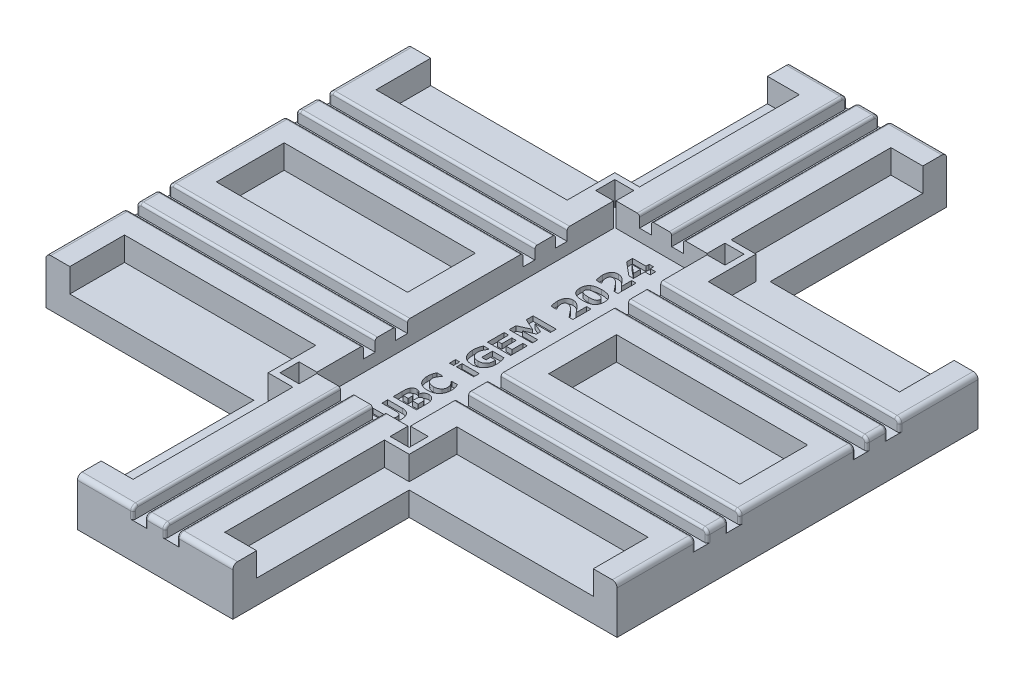
from build123d import *

# Parameters (mm, degrees)
SKETCH1_W                                  = 240
SKETCH1_H                                  = 200
BOSS_EXTRUDE1_DEPTH                        = 20
SKETCH7_W                                  = 120
SKETCH7_H                                  = 50
BOSS_EXTRUDE6_DEPTH                        = 20
FILLET1_R                                  = 2
SKETCH2_W                                  = 39.3
SKETCH2_H                                  = 125.7
CUT_EXTRUDE1_DEPTH                         = 10
CUT_EXTRUDE3_DEPTH                         = 5
MIRROR4_AT_THE_SECOND_PLANE_COPY_1_DEPTH   = 5
SKETCH11_W                                 = 104.748042719
SKETCH11_H                                 = 5
CUT_EXTRUDE4_DEPTH                         = 5
MIRROR6_AT_THE_SECOND_PLANE_COPY_1_SKETC_W = 104.748042719
MIRROR6_AT_THE_SECOND_PLANE_COPY_1_SKETC_H = 5
MIRROR6_AT_THE_SECOND_PLANE_COPY_1_DEPTH   = 5
SHELL1_START                               = 10
SHELL1_OUTLINE_W                           = 80.35
SHELL1_OUTLINE_H                           = 28.5
SHELL1_DEPTH                               = 10
FILLET3_R                                  = 1
SKETCH13_W                                 = 7.252545243
SKETCH13_H                                 = 2.335565418
SKETCH13_W_2                               = 1.720942939
SKETCH13_H_2                               = 2.581414408
CUT_EXTRUDE5_DEPTH                         = 2
CUT_EXTRUDE6_DEPTH                         = 10
MIRROR7_AT_THE_SECOND_PLANE_COPY_1_DEPTH   = 10
SKETCH15_W                                 = 101.789001661
SKETCH15_H                                 = 87.14110882
CUT_EXTRUDE7_DEPTH                         = 194.132079158


# Read off the part's stored shape, not the designer's step: Shell1
with BuildPart() as part:
    # Sketch1 → Boss-Extrude1 (new body)
    with BuildSketch(Plane(origin=(0, 0, 0), x_dir=(1, 0, 0), z_dir=(0, 1, 0))):
        Rectangle(SKETCH1_W, SKETCH1_H)
    extrude(amount=BOSS_EXTRUDE1_DEPTH)

    # Sketch7 → Boss-Extrude6 (add)
    with BuildSketch(Plane(origin=(0, 0, 0), x_dir=(1, 0, 0), z_dir=(0, 1, 0))):
        with Locations((0, 125)):
            Rectangle(SKETCH7_W, SKETCH7_H)
        with Locations((0, -125)):
            Rectangle(SKETCH7_W, SKETCH7_H)
    extrude(amount=BOSS_EXTRUDE6_DEPTH)

    # Fillet1
    fillet1_edges = [part.edges().sort_by_distance(p)[0] for p in [
        (-120, 20, 0),
        (90, 20, 100),
        (-90, 20, 100),
        (-60, 10, 150),
        (60, 10, 150),
        (-60, 20, 125),
        (0, 20, 150),
        (60, 20, 125),
        (-90, 20, -100),
        (60, 20, -125),
        (0, 20, -150),
        (60, 10, -150),
        (-60, 10, -150),
        (-60, 20, -125),
        (120, 20, 0),
        (120, 10, 100),
        (-120, 10, 100),
        (-120, 10, -100),
        (120, 10, -100),
        (90, 20, -100),
    ]]
    fillet(fillet1_edges, radius=FILLET1_R)

    # Sketch2 → Cut-Extrude1 (cut)
    with BuildSketch(Plane(origin=(0, 20, 0), x_dir=(1, 0, 0), z_dir=(0, 1, 0))):
        Rectangle(SKETCH2_W, SKETCH2_H)
    extrude(amount=-CUT_EXTRUDE1_DEPTH, mode=Mode.SUBTRACT)

    # Sketch10 → Cut-Extrude3 (cut)
    with BuildSketch(Plane(origin=(0, 20, 0), x_dir=(1, 0, 0), z_dir=(0, 1, 0))):
        Polygon((-9.25, -40.5), (-9.25, -33.162899401), (-4.25, -33.162899401), (-4.25, -40.5), (-4.25, -156.832928994), (-9.25, -156.832928994), align=None)
    cut_extrude3 = extrude(amount=-CUT_EXTRUDE3_DEPTH, mode=Mode.SUBTRACT)

    # Mirror4: Cut-Extrude3 across plane
    add(cut_extrude3.mirror(Plane(origin=(0, 0, 0), x_dir=(0, 0, 1), z_dir=(1, 0, 0))), mode=Mode.SUBTRACT)

    # Mirror4 at the second plane: Cut-Extrude3 across plane
    add(cut_extrude3.mirror(Plane.XY), mode=Mode.SUBTRACT)

    # Mirror4 at the second plane copy 1 sketc → Mirror4 at the second plane copy 1 (cut)
    with BuildSketch(Plane(origin=(0, 20, 0), x_dir=(-1, 0, 0), z_dir=(0, 1, 0))):
        Polygon((-9.25, -40.5), (-9.25, -33.162899401), (-4.25, -33.162899401), (-4.25, -40.5), (-4.25, -156.832928994), (-9.25, -156.832928994), align=None)
    extrude(amount=-MIRROR4_AT_THE_SECOND_PLANE_COPY_1_DEPTH, mode=Mode.SUBTRACT)

    # Sketch11 → Cut-Extrude4 (cut)
    with BuildSketch(Plane(origin=(0, 20, 0), x_dir=(1, 0, 0), z_dir=(0, 1, 0))):
        with Locations((-72.024021359, 26.75)):
            Rectangle(SKETCH11_W, SKETCH11_H)
        with Locations((-72.024021359, 40.35)):
            Rectangle(SKETCH11_W, SKETCH11_H)
    cut_extrude4 = extrude(amount=-CUT_EXTRUDE4_DEPTH, mode=Mode.SUBTRACT)

    # Mirror6: Cut-Extrude4 across plane
    add(cut_extrude4.mirror(Plane.XY), mode=Mode.SUBTRACT)

    # Mirror6 at the second plane: Cut-Extrude4 across plane
    add(cut_extrude4.mirror(Plane(origin=(0, 0, 0), x_dir=(0, 0, 1), z_dir=(1, 0, 0))), mode=Mode.SUBTRACT)

    # Mirror6 at the second plane copy 1 sketc → Mirror6 at the second plane copy 1 (cut)
    with BuildSketch(Plane(origin=(0, 20, 0), x_dir=(-1, 0, 0), z_dir=(0, 1, 0))):
        with Locations((-72.024021359, 26.75)):
            Rectangle(MIRROR6_AT_THE_SECOND_PLANE_COPY_1_SKETC_W, MIRROR6_AT_THE_SECOND_PLANE_COPY_1_SKETC_H)
        with Locations((-72.024021359, 40.35)):
            Rectangle(MIRROR6_AT_THE_SECOND_PLANE_COPY_1_SKETC_W, MIRROR6_AT_THE_SECOND_PLANE_COPY_1_SKETC_H)
    extrude(amount=-MIRROR6_AT_THE_SECOND_PLANE_COPY_1_DEPTH, mode=Mode.SUBTRACT)

    # Shell1 outline → Shell1 (cut)
    with BuildSketch(Plane(origin=(0, 0, 0), x_dir=(1, 0, 0), z_dir=(0, 1, 0)).offset(SHELL1_START)):
        Polygon((-29.65, 72.85), (-19.25, 72.85), (-19.25, 140), (-50, 140), (-50, 90), (-110, 90), (-110, 52.85), (-29.65, 52.85), align=None)
        Polygon((19.25, 72.85), (29.65, 72.85), (29.65, 52.85), (110, 52.85), (110, 90), (50, 90), (50, 140), (19.25, 140), align=None)
        Polygon((-110, -52.85), (-110, -90), (-50, -90), (-50, -140), (-19.25, -140), (-19.25, -72.85), (-29.65, -72.85), (-29.65, -52.85), align=None)
        with Locations((-69.825, 0)):
            Rectangle(SHELL1_OUTLINE_W, SHELL1_OUTLINE_H)
        Polygon((29.65, -72.85), (19.25, -72.85), (19.25, -140), (50, -140), (50, -90), (110, -90), (110, -52.85), (29.65, -52.85), align=None)
        with Locations((69.825, 0)):
            Rectangle(SHELL1_OUTLINE_W, SHELL1_OUTLINE_H)
    extrude(amount=SHELL1_DEPTH, mode=Mode.SUBTRACT)

    # Fillet3
    fillet3_edges = [part.edges().sort_by_distance(p)[0] for p in [
        (-4.25, 16.5, 150),
        (-4.25, 19.414213562, 149.414213562),
        (-9.25, 16.5, 150),
        (-9.25, 19.414213562, 149.414213562),
        (-4.25, 20, 105.425),
        (-9.25, 20, 105.425),
        (-9.25, 19.414213562, -149.414213562),
        (-9.25, 16.5, -150),
        (-9.25, 20, -105.425),
        (-4.25, 16.5, -150),
        (-4.25, 19.414213562, -149.414213562),
        (-4.25, 20, -105.425),
        (9.25, 16.5, 150),
        (9.25, 20, 105.425),
        (9.25, 19.414213562, 149.414213562),
        (4.25, 16.5, 150),
        (4.25, 19.414213562, 149.414213562),
        (4.25, 20, 105.425),
        (4.25, 16.5, -150),
        (4.25, 19.414213562, -149.414213562),
        (9.25, 19.414213562, -149.414213562),
        (9.25, 16.5, -150),
        (4.25, 20, -105.425),
        (9.25, 20, -105.425),
        (-120, 16.5, -24.25),
        (-120, 16.5, -29.25),
        (-119.414213562, 19.414213562, -24.25),
        (-119.414213562, 19.414213562, -29.25),
        (-68.825, 20, -24.25),
        (-68.825, 20, -29.25),
        (-120, 16.5, -37.85),
        (-120, 16.5, -42.85),
        (-68.825, 20, -37.85),
        (-68.825, 20, -42.85),
        (-119.414213562, 19.414213562, -37.85),
        (-119.414213562, 19.414213562, -42.85),
        (68.825, 20, -29.25),
        (119.414213562, 19.414213562, -29.25),
        (119.414213562, 19.414213562, -24.25),
        (68.825, 20, -24.25),
        (120, 16.5, -29.25),
        (120, 16.5, -24.25),
        (68.825, 20, -42.85),
        (119.414213562, 19.414213562, -42.85),
        (119.414213562, 19.414213562, -37.85),
        (68.825, 20, -37.85),
        (120, 16.5, -42.85),
        (120, 16.5, -37.85),
        (-120, 16.5, 29.25),
        (-120, 16.5, 24.25),
        (-68.825, 20, 29.25),
        (-119.414213562, 19.414213562, 29.25),
        (-119.414213562, 19.414213562, 24.25),
        (-68.825, 20, 24.25),
        (-120, 16.5, 42.85),
        (-120, 16.5, 37.85),
        (-68.825, 20, 42.85),
        (-119.414213562, 19.414213562, 42.85),
        (-119.414213562, 19.414213562, 37.85),
        (-68.825, 20, 37.85),
        (120, 16.5, 24.25),
        (120, 16.5, 29.25),
        (119.414213562, 19.414213562, 24.25),
        (119.414213562, 19.414213562, 29.25),
        (68.825, 20, 24.25),
        (68.825, 20, 29.25),
        (120, 16.5, 37.85),
        (120, 16.5, 42.85),
        (68.825, 20, 37.85),
        (68.825, 20, 42.85),
        (119.414213562, 19.414213562, 37.85),
        (119.414213562, 19.414213562, 42.85),
    ]]
    fillet(fillet3_edges, radius=FILLET3_R)

    # Sketch13 → Cut-Extrude5 (cut)
    # profile 1 of 12: a face of its own
    with BuildSketch(Plane(origin=(0, 10, 0), x_dir=(1, 0, 0), z_dir=(0, 1, 0))):
        Polygon((2.787359078, 56.729654742), (2.787359078, 55.37748529), (5, 55.37748529), (5, 53.041919872), (2.787359078, 53.041919872), (2.787359078, 48.247864542), (0.880108701, 48.247864542), (-4.711035156, 52.886343558), (-4.711035156, 55.37748529), (0.943491644, 55.37748529), (0.943491644, 56.729654742), align=None)
        Polygon((0.943491644, 53.041919872), (-2.596349692, 53.041919872), (0.943491644, 50.110938929), align=None, mode=Mode.SUBTRACT)
    # profile 2 of 12: a face of its own
    with BuildSketch(Plane(origin=(0, 10, 0), x_dir=(1, 0, 0), z_dir=(0, 1, 0))):
        with BuildLine():
            Line((5, 47.141544081), (5, 39.520225351))
            Line((5, 39.520225351), (3.409664338, 39.520225351))
            add(Edge.make_bspline(
                [(3.409664338, 39.520225351), (3.190599668, 39.81675512), (2.747057383, 40.417141716), (2.167094132, 41.14339637), (1.704390868, 41.703253096), (1.381972101, 42.083056551), (1.083256561, 42.417759603), (0.887687077, 42.622007507), (0.79559811, 42.718182933)],
                knots=[0, 0, 0, 0, 1.605452287, 3.25057426, 4.046675402, 4.768563423, 5.420146126, 6, 6, 6, 6], degree=3))
            add(Edge.make_bspline(
                [(0.79559811, 42.718182933), (0.732570292, 42.782561984), (0.609352585, 42.908421315), (0.423765416, 43.085974145), (0.244476812, 43.249198615), (0.074088064, 43.400664381), (-0.092796487, 43.534082219), (-0.252790737, 43.654099684), (-0.406497488, 43.759962438), (-0.599845109, 43.881290453), (-0.837875375, 44.00401532), (-1.125540586, 44.112139625), (-1.412736444, 44.178491494), (-1.604945873, 44.187117789), (-1.699385013, 44.191356186)],
                knots=[0, 0, 0, 0, 1.090093853, 2.131104457, 3.107135244, 4.023908394, 4.888948297, 5.691514549, 6.4435893, 7.146498757, 8.452673016, 9.675803408, 10.85804184, 12, 12, 12, 12], degree=3))
            add(Edge.make_bspline(
                [(-1.699385013, 44.191356186), (-1.754483363, 44.189605987), (-1.861179083, 44.186216799), (-2.017224671, 44.167846758), (-2.162681909, 44.132103765), (-2.300488192, 44.087839319), (-2.42643972, 44.024206924), (-2.544199113, 43.950411254), (-2.650531499, 43.859818439), (-2.749307162, 43.758726543), (-2.834556733, 43.642742478), (-2.911599654, 43.517157005), (-2.971430142, 43.377241787), (-3.024398474, 43.226819474), (-3.063653395, 43.063897589), (-3.092633036, 42.889340485), (-3.109905835, 42.703165878), (-3.111960528, 42.574807759), (-3.113016713, 42.508827152)],
                knots=[0, 0, 0, 0, 1.058578686, 2.049894692, 3.010224385, 3.931750511, 4.822578239, 5.71281177, 6.594427321, 7.498813824, 8.420995957, 9.353043897, 10.321837571, 11.3367408, 12.413304787, 13.535187771, 14.732999458, 16, 16, 16, 16], degree=3))
            add(Edge.make_bspline(
                [(-3.113016713, 42.508827152), (-3.110052719, 42.405568465), (-3.104041103, 42.196137688), (-3.053985994, 41.878413923), (-2.980602684, 41.552282773), (-2.873221808, 41.222921491), (-2.74714341, 40.895094854), (-2.596251992, 40.578640505), (-2.438170844, 40.269132893), (-2.314289691, 40.074405983), (-2.252545243, 39.977350819)],
                knots=[0, 0, 0, 0, 0.914703558, 1.855215137, 2.844920106, 3.875005138, 4.922433174, 5.955639304, 6.981056277, 8, 8, 8, 8], degree=3))
            Line((-2.252545243, 39.977350819), (-2.252545243, 39.766074342))
            Line((-2.252545243, 39.766074342), (-4.363389317, 39.766074342))
            add(Edge.make_bspline(
                [(-4.363389317, 39.766074342), (-4.396975153, 39.85152697), (-4.470639347, 40.038951181), (-4.568658946, 40.352153969), (-4.66491051, 40.720660415), (-4.763825821, 41.132864511), (-4.849735205, 41.573321973), (-4.910075419, 42.024211578), (-4.95119256, 42.474770211), (-4.954991729, 42.775713815), (-4.956884148, 42.92561802)],
                knots=[0, 0, 0, 0, 0.681686624, 1.495150967, 2.435076171, 3.509887788, 4.642826517, 5.765734475, 6.887081194, 8, 8, 8, 8], degree=3))
            add(Edge.make_bspline(
                [(-4.956884148, 42.92561802), (-4.954912362, 43.072306092), (-4.951074185, 43.357841566), (-4.914531776, 43.772464491), (-4.853049644, 44.160650299), (-4.769612134, 44.521836328), (-4.662431161, 44.856562797), (-4.529987596, 45.163893905), (-4.371768891, 45.443672956), (-4.191325, 45.69718541), (-3.986517109, 45.920499957), (-3.762299213, 46.116633841), (-3.516918106, 46.283180062), (-3.250583577, 46.417510178), (-2.964907945, 46.521931142), (-2.659732708, 46.596780352), (-2.333869778, 46.641015432), (-2.109911454, 46.646854566), (-1.995172081, 46.649846099)],
                knots=[0, 0, 0, 0, 1.302669921, 2.535710425, 3.693104205, 4.791067539, 5.825099944, 6.810730835, 7.758000335, 8.67487823, 9.568447078, 10.443087854, 11.315285082, 12.19521531, 13.085757283, 14.011200708, 14.981089066, 16, 16, 16, 16], degree=3))
            add(Edge.make_bspline(
                [(-1.995172081, 46.649846099), (-1.918295051, 46.648245135), (-1.764899121, 46.645050664), (-1.536586701, 46.623146341), (-1.311198259, 46.589276583), (-1.089189633, 46.538876948), (-0.870129482, 46.472993238), (-0.653296175, 46.39436831), (-0.439122967, 46.302496277), (-0.229338943, 46.193054838), (-0.018163961, 46.072147599), (0.191952814, 45.932794317), (0.405837655, 45.781094454), (0.620958688, 45.614342324), (0.835471411, 45.430057751), (1.055741697, 45.23549192), (1.273520634, 45.021368665), (1.417594688, 44.872241147), (1.490889788, 44.796375188)],
                knots=[0, 0, 0, 0, 0.907170522, 1.810115022, 2.704515666, 3.595334857, 4.494160497, 5.402400165, 6.316123003, 7.242010315, 8.19323076, 9.186549597, 10.215937183, 11.28746875, 12.397107329, 13.552885457, 14.755074217, 16, 16, 16, 16], degree=3))
            add(Edge.make_bspline(
                [(1.490889788, 44.796375188), (1.669671754, 44.600991906), (2.021428479, 44.216571794), (2.422503942, 43.720261203), (2.710127438, 43.347225494), (2.892573427, 43.11547907), (3.035611297, 42.923413887), (3.11966375, 42.809753418), (3.156132565, 42.760438229)],
                knots=[0, 0, 0, 0, 1.811045763, 3.563265038, 4.362127914, 5.033096026, 5.580478129, 6, 6, 6, 6], degree=3))
            Line((3.156132565, 42.760438229), (3.156132565, 47.141544081))
            Line((3.156132565, 47.141544081), (5, 47.141544081))
        make_face()
    # profile 3 of 12: a face of its own
    with BuildSketch(Plane(origin=(0, 10, 0), x_dir=(1, 0, 0), z_dir=(0, 1, 0))):
        with BuildLine():
            add(Edge.make_bspline(
                [(0.138720336, 37.553433421), (0.339837036, 37.551198694), (0.731017162, 37.546852061), (1.301575539, 37.503210957), (1.839727263, 37.435290008), (2.344336806, 37.340402007), (2.812295891, 37.218717557), (3.235819492, 37.059739443), (3.620265586, 36.877229499), (3.845547684, 36.720963882), (3.955141787, 36.64494457)],
                knots=[0, 0, 0, 0, 1.210994604, 2.355433537, 3.443919748, 4.476135166, 5.446013627, 6.351277171, 7.197937607, 8, 8, 8, 8], degree=3))
            add(Edge.make_bspline(
                [(3.955141787, 36.64494457), (4.057367971, 36.5617232), (4.260610648, 36.396265258), (4.524020765, 36.101981434), (4.745368417, 35.772676286), (4.897303004, 35.472877401), (4.999247268, 35.217133399), (5.063592063, 35.011802969), (5.122267484, 34.796985151), (5.167723638, 34.570405454), (5.201934481, 34.333084121), (5.226664862, 34.085073274), (5.242295446, 33.825562266), (5.244648027, 33.648682389), (5.245848991, 33.558387312)],
                knots=[0, 0, 0, 0, 1.363120718, 2.710110989, 4.070537742, 5.460816644, 6.180869889, 6.918733188, 7.687278466, 8.485437086, 9.309407483, 10.168795045, 11.065191617, 12, 12, 12, 12], degree=3))
            add(Edge.make_bspline(
                [(5.245848991, 33.558387312), (5.241905689, 33.384062955), (5.234297073, 33.047703496), (5.173081199, 32.562988904), (5.069699732, 32.118069919), (4.926806373, 31.711596248), (4.739854178, 31.34454147), (4.516760058, 31.013155063), (4.251279595, 30.717979546), (4.045332533, 30.554230832), (3.94169692, 30.471830054)],
                knots=[0, 0, 0, 0, 1.200851745, 2.317047666, 3.359233085, 4.342911255, 5.278031965, 6.189548012, 7.088953741, 8, 8, 8, 8], degree=3))
            add(Edge.make_bspline(
                [(3.94169692, 30.471830054), (3.829424185, 30.3947628), (3.600170882, 30.2373967), (3.214838014, 30.049115343), (2.792701976, 29.89168932), (2.331256748, 29.768085058), (1.834031119, 29.675388633), (1.301418942, 29.61187027), (0.734794995, 29.570336966), (0.344952566, 29.565716964), (0.144482422, 29.563341204)],
                knots=[0, 0, 0, 0, 0.822750793, 1.680001256, 2.58557045, 3.544707477, 4.565467581, 5.642347189, 6.787615291, 8, 8, 8, 8], degree=3))
            add(Edge.make_bspline(
                [(0.144482422, 29.563341204), (-0.061754837, 29.565532126), (-0.459970452, 29.569762495), (-1.036345286, 29.613069323), (-1.570746564, 29.680774054), (-2.065452333, 29.775711056), (-2.521358164, 29.900947264), (-2.938473361, 30.06222162), (-3.323134476, 30.249194002), (-3.55325365, 30.406272972), (-3.666176943, 30.483354226)],
                knots=[0, 0, 0, 0, 1.242237956, 2.39858964, 3.479780431, 4.485821505, 5.430991799, 6.32348679, 7.177307181, 8, 8, 8, 8], degree=3))
            add(Edge.make_bspline(
                [(-3.666176943, 30.483354226), (-3.769193286, 30.566416838), (-3.974708441, 30.732124775), (-4.238285133, 31.029639616), (-4.461065672, 31.362253167), (-4.645070962, 31.729678272), (-4.784115122, 32.135791847), (-4.885860052, 32.577168574), (-4.944671996, 33.056148657), (-4.952723667, 33.387282789), (-4.956884148, 33.558387312)],
                knots=[0, 0, 0, 0, 0.915406887, 1.826214983, 2.74012738, 3.682217607, 4.664024873, 5.706462388, 6.814877053, 8, 8, 8, 8], degree=3))
            add(Edge.make_bspline(
                [(-4.956884148, 33.558387312), (-4.955682618, 33.64868302), (-4.953320425, 33.826203271), (-4.937576888, 34.086978277), (-4.913381513, 34.337057391), (-4.877300412, 34.575699285), (-4.828262853, 34.80214551), (-4.773499009, 35.018778584), (-4.706561244, 35.224310597), (-4.601886899, 35.480626422), (-4.447267393, 35.781827029), (-4.217150947, 36.109134402), (-3.948246131, 36.405401156), (-3.739143401, 36.569659884), (-3.633525124, 36.652627351)],
                knots=[0, 0, 0, 0, 0.927772364, 1.823989051, 2.683453821, 3.508702832, 4.302191287, 5.063276402, 5.803871599, 6.520953588, 7.906777029, 9.27188215, 10.622021304, 12, 12, 12, 12], degree=3))
            add(Edge.make_bspline(
                [(-3.633525124, 36.652627351), (-3.521300204, 36.729189524), (-3.292789343, 36.885084383), (-2.908970475, 37.068290297), (-2.492360426, 37.225455121), (-2.036263275, 37.346342452), (-1.54437137, 37.439204828), (-1.015826808, 37.505677425), (-0.450933502, 37.546286922), (-0.061742996, 37.551003841), (0.138720336, 37.553433421)],
                knots=[0, 0, 0, 0, 0.826423845, 1.682753026, 2.582377666, 3.535958882, 4.552416628, 5.629628825, 6.779074777, 8, 8, 8, 8], degree=3))
        make_face()
        with BuildLine():
            add(Edge.make_bspline(
                [(0.138720336, 35.094943508), (-0.002794049, 35.093990238), (-0.275052116, 35.092156251), (-0.667644343, 35.074004214), (-1.028464631, 35.048543297), (-1.357952356, 35.010483072), (-1.656192237, 34.961169576), (-1.923473104, 34.900935006), (-2.158488294, 34.828227196), (-2.363936988, 34.745989678), (-2.54162794, 34.64913888), (-2.69467252, 34.537908006), (-2.823572221, 34.410664927), (-2.931286275, 34.270097317), (-3.011274034, 34.111739825), (-3.072443859, 33.941187009), (-3.106785969, 33.754382189), (-3.110895684, 33.625106618), (-3.113016713, 33.558387312)],
                knots=[0, 0, 0, 0, 1.684598718, 3.240982106, 4.677870026, 5.990101975, 7.188004416, 8.275163324, 9.249099904, 10.113910365, 10.905306099, 11.652292794, 12.358339015, 13.054983843, 13.750418457, 14.461547751, 15.206002611, 16, 16, 16, 16], degree=3))
            add(Edge.make_bspline(
                [(-3.113016713, 33.558387312), (-3.110895681, 33.491668012), (-3.106785962, 33.362392453), (-3.072443884, 33.175587552), (-3.011273943, 33.005035023), (-2.931286606, 32.84667649), (-2.823570979, 32.706112772), (-2.694677343, 32.578854684), (-2.541608299, 32.467684345), (-2.363496496, 32.37029911), (-2.157013742, 32.289020864), (-1.921590867, 32.215742751), (-1.654258135, 32.155647372), (-1.355414385, 32.106122047), (-1.024612933, 32.068276855), (-0.661244964, 32.04269777), (-0.266085327, 32.024665897), (0.008090715, 32.022799039), (0.150244508, 32.021831116)],
                knots=[0, 0, 0, 0, 0.791766581, 1.534129826, 2.243261137, 2.936741863, 3.631429404, 4.335491923, 5.08037989, 5.869552125, 6.738971147, 7.710171362, 8.794275798, 9.988812621, 11.304907075, 12.745337551, 14.312534512, 16, 16, 16, 16], degree=3))
            add(Edge.make_bspline(
                [(0.150244508, 32.021831116), (0.289201434, 32.022765136), (0.556986265, 32.024565091), (0.943773412, 32.043063349), (1.30096878, 32.067483158), (1.627502144, 32.109075315), (1.924420257, 32.156514098), (2.190195476, 32.220950105), (2.427221865, 32.292197549), (2.635687527, 32.376524358), (2.816464841, 32.475577579), (2.974492505, 32.586386469), (3.106149375, 32.714997304), (3.215613674, 32.855867424), (3.298888327, 33.012083539), (3.358752163, 33.181622444), (3.396338685, 33.365314373), (3.400067537, 33.492898418), (3.401981557, 33.558387312)],
                knots=[0, 0, 0, 0, 1.658832269, 3.196746878, 4.622488866, 5.931787449, 7.125569234, 8.210133994, 9.194149195, 10.078471196, 10.889203548, 11.650697572, 12.375032472, 13.07829054, 13.77251817, 14.478471121, 15.218999177, 16, 16, 16, 16], degree=3))
            add(Edge.make_bspline(
                [(3.401981557, 33.558387312), (3.400068186, 33.623876875), (3.3963406, 33.751462223), (3.358745104, 33.935144911), (3.298913291, 34.10471679), (3.215521541, 34.260812329), (3.106775331, 34.40178813), (2.97377315, 34.528364287), (2.816557237, 34.639341559), (2.635707586, 34.738476019), (2.42683161, 34.821967534), (2.190341985, 34.897522561), (1.921851262, 34.956560743), (1.624132619, 35.009519497), (1.295502071, 35.045529443), (0.936895825, 35.074962985), (0.547988509, 35.091838226), (0.278306115, 35.093884415), (0.138720336, 35.094943508)],
                knots=[0, 0, 0, 0, 0.778971247, 1.517574904, 2.221693305, 2.914116855, 3.615547377, 4.332711038, 5.092226179, 5.900851692, 6.782875619, 7.766611013, 8.854037796, 10.053520173, 11.366075456, 12.788704916, 14.337855446, 16, 16, 16, 16], degree=3))
        make_face(mode=Mode.SUBTRACT)
    # profile 4 of 12: a face of its own
    with BuildSketch(Plane(origin=(0, 10, 0), x_dir=(1, 0, 0), z_dir=(0, 1, 0))):
        with BuildLine():
            Line((5, 28.211171751), (5, 20.589853021))
            Line((5, 20.589853021), (3.409664338, 20.589853021))
            add(Edge.make_bspline(
                [(3.409664338, 20.589853021), (3.190599668, 20.88638279), (2.747057383, 21.486769386), (2.167094132, 22.21302404), (1.704390868, 22.772880767), (1.381972101, 23.152684221), (1.083256561, 23.487387273), (0.887687077, 23.691635177), (0.79559811, 23.787810603)],
                knots=[0, 0, 0, 0, 1.605452287, 3.25057426, 4.046675402, 4.768563423, 5.420146126, 6, 6, 6, 6], degree=3))
            add(Edge.make_bspline(
                [(0.79559811, 23.787810603), (0.732570292, 23.852189654), (0.609352585, 23.978048985), (0.423765416, 24.155601815), (0.244476812, 24.318826285), (0.074088064, 24.470292051), (-0.092796487, 24.60370989), (-0.252790737, 24.723727355), (-0.406497488, 24.829590108), (-0.599845109, 24.950918123), (-0.837875375, 25.07364299), (-1.125540586, 25.181767295), (-1.412736444, 25.248119164), (-1.604945873, 25.256745459), (-1.699385013, 25.260983856)],
                knots=[0, 0, 0, 0, 1.090093853, 2.131104457, 3.107135244, 4.023908394, 4.888948297, 5.691514549, 6.4435893, 7.146498757, 8.452673016, 9.675803408, 10.85804184, 12, 12, 12, 12], degree=3))
            add(Edge.make_bspline(
                [(-1.699385013, 25.260983856), (-1.754483363, 25.259233658), (-1.861179083, 25.25584447), (-2.017224671, 25.237474428), (-2.162681909, 25.201731435), (-2.300488192, 25.157466989), (-2.42643972, 25.093834595), (-2.544199113, 25.020038924), (-2.650531499, 24.929446109), (-2.749307162, 24.828354213), (-2.834556733, 24.712370148), (-2.911599654, 24.586784675), (-2.971430142, 24.446869457), (-3.024398474, 24.296447144), (-3.063653395, 24.133525259), (-3.092633036, 23.958968155), (-3.109905835, 23.772793548), (-3.111960528, 23.644435429), (-3.113016713, 23.578454822)],
                knots=[0, 0, 0, 0, 1.058578686, 2.049894692, 3.010224385, 3.931750511, 4.822578239, 5.71281177, 6.594427321, 7.498813824, 8.420995957, 9.353043897, 10.321837571, 11.3367408, 12.413304787, 13.535187771, 14.732999458, 16, 16, 16, 16], degree=3))
            add(Edge.make_bspline(
                [(-3.113016713, 23.578454822), (-3.110052719, 23.475196136), (-3.104041103, 23.265765358), (-3.053985994, 22.948041593), (-2.980602684, 22.621910443), (-2.873221808, 22.292549161), (-2.74714341, 21.964722525), (-2.596251992, 21.648268175), (-2.438170844, 21.338760563), (-2.314289691, 21.144033653), (-2.252545243, 21.046978489)],
                knots=[0, 0, 0, 0, 0.914703558, 1.855215137, 2.844920106, 3.875005138, 4.922433174, 5.955639304, 6.981056277, 8, 8, 8, 8], degree=3))
            Line((-2.252545243, 21.046978489), (-2.252545243, 20.835702012))
            Line((-2.252545243, 20.835702012), (-4.363389317, 20.835702012))
            add(Edge.make_bspline(
                [(-4.363389317, 20.835702012), (-4.396975153, 20.92115464), (-4.470639347, 21.108578851), (-4.568658946, 21.421781639), (-4.66491051, 21.790288086), (-4.763825821, 22.202492181), (-4.849735205, 22.642949643), (-4.910075419, 23.093839248), (-4.95119256, 23.544397881), (-4.954991729, 23.845341485), (-4.956884148, 23.99524569)],
                knots=[0, 0, 0, 0, 0.681686624, 1.495150967, 2.435076171, 3.509887788, 4.642826517, 5.765734475, 6.887081194, 8, 8, 8, 8], degree=3))
            add(Edge.make_bspline(
                [(-4.956884148, 23.99524569), (-4.954912362, 24.141933762), (-4.951074185, 24.427469237), (-4.914531776, 24.842092162), (-4.853049644, 25.230277969), (-4.769612134, 25.591463998), (-4.662431161, 25.926190468), (-4.529987596, 26.233521576), (-4.371768891, 26.513300626), (-4.191325, 26.76681308), (-3.986517109, 26.990127627), (-3.762299213, 27.186261512), (-3.516918106, 27.352807733), (-3.250583577, 27.487137848), (-2.964907945, 27.591558812), (-2.659732708, 27.666408023), (-2.333869778, 27.710643103), (-2.109911454, 27.716482236), (-1.995172081, 27.719473769)],
                knots=[0, 0, 0, 0, 1.302669921, 2.535710425, 3.693104205, 4.791067539, 5.825099944, 6.810730835, 7.758000335, 8.67487823, 9.568447078, 10.443087854, 11.315285082, 12.19521531, 13.085757283, 14.011200708, 14.981089066, 16, 16, 16, 16], degree=3))
            add(Edge.make_bspline(
                [(-1.995172081, 27.719473769), (-1.918295051, 27.717872805), (-1.764899121, 27.714678334), (-1.536586701, 27.692774011), (-1.311198259, 27.658904253), (-1.089189633, 27.608504619), (-0.870129482, 27.542620908), (-0.653296175, 27.46399598), (-0.439122967, 27.372123947), (-0.229338943, 27.262682508), (-0.018163961, 27.141775269), (0.191952814, 27.002421987), (0.405837655, 26.850722124), (0.620958688, 26.683969994), (0.835471411, 26.499685422), (1.055741697, 26.30511959), (1.273520634, 26.090996335), (1.417594688, 25.941868817), (1.490889788, 25.866002858)],
                knots=[0, 0, 0, 0, 0.907170522, 1.810115022, 2.704515666, 3.595334857, 4.494160497, 5.402400165, 6.316123003, 7.242010315, 8.19323076, 9.186549597, 10.215937183, 11.28746875, 12.397107329, 13.552885457, 14.755074217, 16, 16, 16, 16], degree=3))
            add(Edge.make_bspline(
                [(1.490889788, 25.866002858), (1.669671754, 25.670619576), (2.021428479, 25.286199464), (2.422503942, 24.789888873), (2.710127438, 24.416853164), (2.892573427, 24.18510674), (3.035611297, 23.993041557), (3.11966375, 23.879381088), (3.156132565, 23.830065899)],
                knots=[0, 0, 0, 0, 1.811045763, 3.563265038, 4.362127914, 5.033096026, 5.580478129, 6, 6, 6, 6], degree=3))
            Line((3.156132565, 23.830065899), (3.156132565, 28.211171751))
            Line((3.156132565, 28.211171751), (5, 28.211171751))
        make_face()
    # profile 5 of 12: a face of its own
    with BuildSketch(Plane(origin=(0, 10, 0), x_dir=(1, 0, 0), z_dir=(0, 1, 0))):
        Polygon((5, 13.583156769), (5, 11.124666856), (-1.524601746, 11.124666856), (2.664434583, 9.338420279), (2.664434583, 7.625160121), (-1.524601746, 5.838913543), (5, 5.838913543), (5, 3.503348126), (-4.711035156, 3.503348126), (-4.711035156, 6.382470298), (0.125275469, 8.549014533), (-4.711035156, 10.709796683), (-4.711035156, 13.583156769), align=None)
    # profile 6 of 12: a face of its own
    with BuildSketch(Plane(origin=(0, 10, 0), x_dir=(1, 0, 0), z_dir=(0, 1, 0))):
        Polygon((5, 1.4136317), (5, -5.593064552), (-4.711035156, -5.593064552), (-4.711035156, 1.4136317), (-2.867167722, 1.4136317), (-2.867167722, -3.134574639), (-1.146224782, -3.134574639), (-1.146224782, 1.044858213), (0.697642652, 1.044858213), (0.697642652, -3.134574639), (3.156132565, -3.134574639), (3.156132565, 1.4136317), align=None)
    # profile 7 of 12: a face of its own
    with BuildSketch(Plane(origin=(0, 10, 0), x_dir=(1, 0, 0), z_dir=(0, 1, 0))):
        with BuildLine():
            add(Edge.make_bspline(
                [(4.475650198, -7.805705474), (4.519354839, -7.923859504), (4.612512661, -8.17570855), (4.743574124, -8.583890089), (4.866671289, -9.047274178), (4.996208031, -9.552124696), (5.106381276, -10.084227717), (5.187397941, -10.625264318), (5.237323662, -11.165972628), (5.243010567, -11.526628491), (5.245848991, -11.706637515)],
                knots=[0, 0, 0, 0, 0.756485239, 1.612472169, 2.573171414, 3.635272123, 4.742182008, 5.834553763, 6.919191659, 8, 8, 8, 8], degree=3))
            add(Edge.make_bspline(
                [(5.245848991, -11.706637515), (5.241962961, -11.909112321), (5.234392087, -12.303579456), (5.17063924, -12.878829296), (5.062937634, -13.419584917), (4.916847086, -13.928231287), (4.72267015, -14.400885619), (4.491042888, -14.842463027), (4.211679163, -15.247896521), (3.893490591, -15.618759753), (3.53655883, -15.9505899), (3.145758166, -16.239699566), (2.72146993, -16.48347792), (2.264846611, -16.681095463), (1.776896349, -16.838089964), (1.255150105, -16.944841813), (0.702111097, -17.014888699), (0.322052776, -17.021601157), (0.127196165, -17.025042647)],
                knots=[0, 0, 0, 0, 1.160705024, 2.261318311, 3.313123859, 4.319096107, 5.290496718, 6.238021168, 7.172737693, 8.107230733, 9.03451477, 9.961071912, 10.888559376, 11.833805606, 12.808979065, 13.821966168, 14.883317984, 16, 16, 16, 16], degree=3))
            add(Edge.make_bspline(
                [(0.127196165, -17.025042647), (-0.058682323, -17.02067815), (-0.422730133, -17.012130168), (-0.955049114, -16.943336637), (-1.460067022, -16.832867692), (-1.937766829, -16.677677821), (-2.386372436, -16.473696921), (-2.808700267, -16.227656485), (-3.203463564, -15.935836699), (-3.565000576, -15.598836264), (-3.895700628, -15.226075236), (-4.177610929, -14.810267907), (-4.422741814, -14.363406013), (-4.616779655, -13.8775432), (-4.772219277, -13.359136807), (-4.876169413, -12.804694831), (-4.946971316, -12.216810998), (-4.953520434, -11.812500101), (-4.956884148, -11.604840667)],
                knots=[0, 0, 0, 0, 1.061573339, 2.079118747, 3.060574866, 4.011305467, 4.942696719, 5.870461571, 6.798745348, 7.740825567, 8.68941507, 9.638984161, 10.604583371, 11.595514188, 12.621960228, 13.691449096, 14.814297672, 16, 16, 16, 16], degree=3))
            add(Edge.make_bspline(
                [(-4.956884148, -11.604840667), (-4.954318925, -11.445386322), (-4.949235323, -11.129389392), (-4.919388643, -10.661251886), (-4.863951384, -10.205248288), (-4.792453594, -9.753475749), (-4.684946461, -9.294730481), (-4.534849919, -8.818874824), (-4.346707534, -8.316660693), (-4.193287983, -7.980233106), (-4.113698935, -7.805705474)],
                knots=[0, 0, 0, 0, 0.974479143, 1.931163549, 2.86485946, 3.780778834, 4.725046501, 5.741022375, 6.828116267, 8, 8, 8, 8], degree=3))
            Line((-4.113698935, -7.805705474), (-1.883771756, -7.805705474))
            Line((-1.883771756, -7.805705474), (-1.883771756, -8.091889065))
            add(Edge.make_bspline(
                [(-1.883771756, -8.091889065), (-1.906716104, -8.126531064), (-1.957410079, -8.203070203), (-2.043059993, -8.326945943), (-2.137489474, -8.476111594), (-2.284548962, -8.694884397), (-2.45960062, -8.978067997), (-2.581693909, -9.213466955), (-2.640525683, -9.326896107)],
                knots=[0, 0, 0, 0, 0.515980687, 1.140024195, 1.869947604, 2.707876564, 4.413660046, 6, 6, 6, 6], degree=3))
            add(Edge.make_bspline(
                [(-2.640525683, -9.326896107), (-2.672756546, -9.393740863), (-2.73882048, -9.530753251), (-2.823836627, -9.749019276), (-2.905177649, -9.981830174), (-2.978097, -10.22950925), (-3.037034138, -10.489919732), (-3.082413494, -10.759686706), (-3.106467195, -11.03779789), (-3.110821171, -11.225783758), (-3.113016713, -11.320577771)],
                knots=[0, 0, 0, 0, 0.861448091, 1.765719082, 2.717953576, 3.724891765, 4.761927522, 5.816719679, 6.89905606, 8, 8, 8, 8], degree=3))
            add(Edge.make_bspline(
                [(-3.113016713, -11.320577771), (-3.110164997, -11.430782772), (-3.104578279, -11.646682304), (-3.068710383, -11.963218824), (-3.004292393, -12.263584213), (-2.918860854, -12.549882667), (-2.805175217, -12.820581595), (-2.662381265, -13.075068024), (-2.499039638, -13.320076357), (-2.36711736, -13.466852812), (-2.300562624, -13.540901474)],
                knots=[0, 0, 0, 0, 1.091217493, 2.137773647, 3.148547478, 4.129133693, 5.092188092, 6.048375109, 7.015406034, 8, 8, 8, 8], degree=3))
            add(Edge.make_bspline(
                [(-2.300562624, -13.540901474), (-2.231129169, -13.608753509), (-2.090799964, -13.745886571), (-1.846186727, -13.91943259), (-1.579009792, -14.07619004), (-1.283734201, -14.208811415), (-0.962723927, -14.314570988), (-0.616833633, -14.387928819), (-0.248028071, -14.435679856), (0.006035391, -14.440927383), (0.136799641, -14.443628239)],
                knots=[0, 0, 0, 0, 0.871242595, 1.760833901, 2.686460846, 3.652134751, 4.663748384, 5.717797841, 6.825370436, 8, 8, 8, 8], degree=3))
            add(Edge.make_bspline(
                [(0.136799641, -14.443628239), (0.270078203, -14.441217619), (0.528956778, -14.436535262), (0.904701948, -14.395518364), (1.257245759, -14.329288021), (1.585144219, -14.233472949), (1.889752999, -14.11198958), (2.170660406, -13.964565335), (2.424839249, -13.78559248), (2.657673098, -13.584235453), (2.862193118, -13.352834409), (3.041867765, -13.096983341), (3.191530728, -12.813783401), (3.315763592, -12.506455713), (3.407777269, -12.172177215), (3.477785429, -11.813452581), (3.51753353, -11.428392977), (3.522401475, -11.163169785), (3.524906052, -11.026711399)],
                knots=[0, 0, 0, 0, 1.162877018, 2.258757441, 3.29433279, 4.289818334, 5.235063129, 6.152415668, 7.05144509, 7.94239879, 8.832861761, 9.739671241, 10.664582224, 11.622279774, 12.626959197, 13.685538709, 14.809200461, 16, 16, 16, 16], degree=3))
            add(Edge.make_bspline(
                [(3.524906052, -11.026711399), (3.524545414, -10.976125561), (3.523787414, -10.869802624), (3.51698298, -10.707868976), (3.511542352, -10.544994826), (3.50110347, -10.438303115), (3.496095624, -10.387119882)],
                knots=[0, 0, 0, 0, 0.947728294, 1.991965744, 3.036685378, 4, 4, 4, 4], degree=3))
            Line((3.496095624, -10.387119882), (1.435189626, -10.387119882))
            Line((1.435189626, -10.387119882), (1.435189626, -12.353911813))
            Line((1.435189626, -12.353911813), (-0.408677809, -12.353911813))
            Line((-0.408677809, -12.353911813), (-0.408677809, -7.805705474))
            Line((-0.408677809, -7.805705474), (4.475650198, -7.805705474))
        make_face()
    # profile 8 of 12: a face of its own
    with BuildSketch(Plane(origin=(0, 10, 0), x_dir=(1, 0, 0), z_dir=(0, 1, 0))):
        with Locations((1.373727378, -19.913768295)):
            Rectangle(SKETCH13_W, SKETCH13_H)
    # profile 9 of 12: a face of its own
    with BuildSketch(Plane(origin=(0, 10, 0), x_dir=(1, 0, 0), z_dir=(0, 1, 0))):
        with Locations((-4.219337174, -19.913768295)):
            Rectangle(SKETCH13_W_2, SKETCH13_H_2)
    # profile 10 of 12: a face of its own
    with BuildSketch(Plane(origin=(0, 10, 0), x_dir=(1, 0, 0), z_dir=(0, 1, 0))):
        with BuildLine():
            add(Edge.make_bspline(
                [(5.245848991, -30.773379208), (5.241556228, -30.949600555), (5.233101922, -31.296656552), (5.17328717, -31.807137753), (5.071443943, -32.296870987), (4.929457053, -32.76358831), (4.750483589, -33.205121013), (4.527408056, -33.614715808), (4.267338932, -33.994815031), (4.061606502, -34.220067298), (3.958983177, -34.332427496)],
                knots=[0, 0, 0, 0, 1.089850102, 2.146385891, 3.173869964, 4.179760968, 5.160008291, 6.115072822, 7.059761785, 8, 8, 8, 8], degree=3))
            add(Edge.make_bspline(
                [(3.958983177, -34.332427496), (3.848038568, -34.438295465), (3.624492228, -34.651612698), (3.240912088, -34.92404395), (2.819806379, -35.161121156), (2.440058042, -35.326067869), (2.118408243, -35.437370727), (1.865302565, -35.510926057), (1.602961267, -35.571890876), (1.331038558, -35.621175666), (1.050675199, -35.662875321), (0.76008365, -35.687900337), (0.460358885, -35.70657835), (0.257194686, -35.708560179), (0.154085898, -35.709565986)],
                knots=[0, 0, 0, 0, 1.326589366, 2.672993315, 4.060770367, 5.505883836, 6.25107509, 7.007321983, 7.7873399, 8.582269437, 9.400071632, 10.240855478, 11.107208546, 12, 12, 12, 12], degree=3))
            add(Edge.make_bspline(
                [(0.154085898, -35.709565986), (-0.036260272, -35.705853317), (-0.409159179, -35.698579988), (-0.954067146, -35.631518817), (-1.472101576, -35.524248732), (-1.962272567, -35.375865598), (-2.421254864, -35.182794221), (-2.847342954, -34.951680217), (-3.242424741, -34.683652344), (-3.47520079, -34.471076121), (-3.591269829, -34.365079315)],
                knots=[0, 0, 0, 0, 1.119324668, 2.1928203, 3.223958197, 4.228260008, 5.200520162, 6.147632129, 7.076354466, 8, 8, 8, 8], degree=3))
            add(Edge.make_bspline(
                [(-3.591269829, -34.365079315), (-3.696426816, -34.256022231), (-3.907914238, -34.036691095), (-4.17855444, -33.660997219), (-4.413868173, -33.249571895), (-4.610724175, -32.802820982), (-4.765892728, -32.325941651), (-4.877010675, -31.82562766), (-4.943259501, -31.303347455), (-4.952287649, -30.948354573), (-4.956884148, -30.767617122)],
                knots=[0, 0, 0, 0, 0.919195442, 1.8486482, 2.803167129, 3.793795735, 4.808307604, 5.844199062, 6.902417522, 8, 8, 8, 8], degree=3))
            add(Edge.make_bspline(
                [(-4.956884148, -30.767617122), (-4.956393428, -30.668359933), (-4.955436829, -30.474869682), (-4.94084827, -30.191814102), (-4.921289403, -29.923828157), (-4.879474294, -29.592200908), (-4.814808823, -29.204474119), (-4.7421777, -28.904822537), (-4.707193766, -28.760490591)],
                knots=[0, 0, 0, 0, 0.880714095, 1.716848845, 2.514717796, 3.264532192, 4.682418473, 6, 6, 6, 6], degree=3))
            add(Edge.make_bspline(
                [(-4.707193766, -28.760490591), (-4.664108705, -28.621612355), (-4.581310973, -28.354726269), (-4.434982607, -27.98111963), (-4.28414942, -27.652264541), (-4.186257609, -27.446632632), (-4.140588669, -27.350700282)],
                knots=[0, 0, 0, 0, 1.146660616, 2.203568899, 3.161920647, 4, 4, 4, 4], degree=3))
            Line((-4.140588669, -27.350700282), (-1.760847261, -27.350700282))
            Line((-1.760847261, -27.350700282), (-1.760847261, -27.636883873))
            add(Edge.make_bspline(
                [(-1.760847261, -27.636883873), (-1.789760882, -27.669445598), (-1.850028949, -27.737317837), (-1.943169449, -27.84646079), (-2.044289807, -27.966859077), (-2.193791638, -28.146156267), (-2.382825876, -28.396964235), (-2.52216278, -28.612309765), (-2.594428997, -28.723997382)],
                knots=[0, 0, 0, 0, 0.571444814, 1.191129738, 1.882836886, 2.634784766, 4.254652092, 6, 6, 6, 6], degree=3))
            add(Edge.make_bspline(
                [(-2.594428997, -28.723997382), (-2.664236929, -28.846886536), (-2.805685787, -29.09589163), (-2.943550161, -29.429418426), (-3.032587435, -29.709146116), (-3.077362003, -29.929392289), (-3.107853006, -30.156624515), (-3.111280534, -30.311028434), (-3.113016713, -30.389240159)],
                knots=[0, 0, 0, 0, 1.439173741, 2.916136845, 3.667290802, 4.427345131, 5.203387771, 6, 6, 6, 6], degree=3))
            add(Edge.make_bspline(
                [(-3.113016713, -30.389240159), (-3.110477824, -30.475745648), (-3.105440763, -30.647369353), (-3.07497042, -30.902187581), (-3.020147889, -31.150575186), (-2.946619655, -31.393340851), (-2.845477271, -31.627774464), (-2.718252775, -31.853674636), (-2.562057311, -32.070037457), (-2.439651919, -32.20231689), (-2.377390434, -32.269600803)],
                knots=[0, 0, 0, 0, 1.001598119, 1.9871338, 2.96553644, 3.943152672, 4.919306753, 5.914963555, 6.939446524, 8, 8, 8, 8], degree=3))
            add(Edge.make_bspline(
                [(-2.377390434, -32.269600803), (-2.309583745, -32.332034441), (-2.171025631, -32.45961311), (-1.93152049, -32.625206542), (-1.660665123, -32.770051169), (-1.360441958, -32.900067806), (-1.026703819, -33.004078191), (-0.659549693, -33.075068855), (-0.259970233, -33.119887624), (0.017588233, -33.125326369), (0.161768679, -33.128151577)],
                knots=[0, 0, 0, 0, 0.80388915, 1.642689914, 2.53299325, 3.481872775, 4.4947599, 5.577680681, 6.741702658, 8, 8, 8, 8], degree=3))
            add(Edge.make_bspline(
                [(0.161768679, -33.128151577), (0.311768837, -33.125923628), (0.599876693, -33.121644368), (1.011428999, -33.069407329), (1.386636838, -32.994288328), (1.721395513, -32.879071876), (2.020823568, -32.741957475), (2.287301408, -32.588864868), (2.521133588, -32.418332338), (2.653723475, -32.287257692), (2.71821405, -32.223504117)],
                knots=[0, 0, 0, 0, 1.290334302, 2.478367041, 3.565730986, 4.578276722, 5.517838544, 6.396912514, 7.220272109, 8, 8, 8, 8], degree=3))
            add(Edge.make_bspline(
                [(2.71821405, -32.223504117), (2.776624204, -32.15678903), (2.892154246, -32.024832576), (3.038823686, -31.808811236), (3.156499876, -31.579934787), (3.248205125, -31.341825956), (3.315689405, -31.098752861), (3.366730598, -30.856410279), (3.396189151, -30.615336617), (3.400060024, -30.45525906), (3.401981557, -30.375795292)],
                knots=[0, 0, 0, 0, 1.054325691, 2.085361559, 3.097224921, 4.110091334, 5.115626892, 6.095649915, 7.054665517, 8, 8, 8, 8], degree=3))
            add(Edge.make_bspline(
                [(3.401981557, -30.375795292), (3.399995416, -30.300167635), (3.396010997, -30.148450175), (3.367969377, -29.92183692), (3.324531763, -29.696128902), (3.260202951, -29.473850088), (3.18176618, -29.256712893), (3.091757836, -29.045457401), (2.985752349, -28.843934907), (2.905928292, -28.715220777), (2.866107583, -28.651010962)],
                knots=[0, 0, 0, 0, 0.991289386, 1.988636345, 2.989438367, 4.001683697, 5.01851186, 6.01479875, 7.009670459, 8, 8, 8, 8], degree=3))
            add(Edge.make_bspline(
                [(2.866107583, -28.651010962), (2.799086235, -28.54754028), (2.667016335, -28.343644611), (2.482727048, -28.10690862), (2.33514417, -27.932313621), (2.23417018, -27.813138173), (2.139586208, -27.707238781), (2.078704196, -27.641290482), (2.049812104, -27.60999414)],
                knots=[0, 0, 0, 0, 1.674278229, 3.299273488, 4.071081905, 4.780574956, 5.421311183, 6, 6, 6, 6], degree=3))
            Line((2.049812104, -27.60999414), (2.049812104, -27.350700282))
            Line((2.049812104, -27.350700282), (4.400743084, -27.350700282))
            add(Edge.make_bspline(
                [(4.400743084, -27.350700282), (4.453977989, -27.469107265), (4.557995254, -27.700466195), (4.710217804, -28.043257711), (4.853488894, -28.385337096), (4.925202683, -28.621478965), (4.961586095, -28.741283639)],
                knots=[0, 0, 0, 0, 1.037949104, 2.028079651, 2.999562103, 4, 4, 4, 4], degree=3))
            add(Edge.make_bspline(
                [(4.961586095, -28.741283639), (5.004421769, -28.893824294), (5.086847599, -29.1873481), (5.164067273, -29.560966602), (5.209771736, -29.869797121), (5.23105018, -30.136648007), (5.244470102, -30.442236078), (5.245371714, -30.658760047), (5.245848991, -30.773379208)],
                knots=[0, 0, 0, 0, 1.383532347, 2.662238992, 3.328886368, 4.109040656, 4.999001483, 6, 6, 6, 6], degree=3))
        make_face()
    # profile 11 of 12: a face of its own
    with BuildSketch(Plane(origin=(0, 10, 0), x_dir=(1, 0, 0), z_dir=(0, 1, 0))):
        with BuildLine():
            add(Edge.make_bspline(
                [(2.021001676, -36.938810942), (2.135834195, -36.941779245), (2.360423317, -36.947584644), (2.687160369, -37.003329886), (2.994969738, -37.09114997), (3.282415269, -37.214700456), (3.547482787, -37.370068437), (3.793917062, -37.547462735), (4.012640519, -37.757602713), (4.139226852, -37.914392754), (4.202911474, -37.993272632)],
                knots=[0, 0, 0, 0, 1.09475917, 2.141126953, 3.152168046, 4.142704369, 5.117043167, 6.078545687, 7.033330935, 8, 8, 8, 8], degree=3))
            add(Edge.make_bspline(
                [(4.202911474, -37.993272632), (4.271430436, -38.089328613), (4.40755836, -38.280164856), (4.576639788, -38.587433573), (4.713481332, -38.908937379), (4.823111743, -39.248810358), (4.903771308, -39.619354907), (4.959791089, -40.029680334), (4.994197282, -40.485748637), (4.998006227, -40.805105318), (5, -40.972270956)],
                knots=[0, 0, 0, 0, 0.900219365, 1.788482918, 2.670971805, 3.564424711, 4.510769046, 5.562163026, 6.723926581, 8, 8, 8, 8], degree=3))
            Line((5, -40.972270956), (5, -45.174752151))
            Line((5, -45.174752151), (-4.711035156, -45.174752151))
            Line((-4.711035156, -45.174752151), (-4.711035156, -41.425555034))
            add(Edge.make_bspline(
                [(-4.711035156, -41.425555034), (-4.710541486, -41.331439942), (-4.70958769, -41.149604829), (-4.705841049, -40.887095211), (-4.699877008, -40.643807445), (-4.693192491, -40.420271668), (-4.681063463, -40.216067051), (-4.668157953, -40.032247924), (-4.652477333, -39.867707729), (-4.630893633, -39.673277593), (-4.585539799, -39.443346024), (-4.510417909, -39.173669198), (-4.412392074, -38.905016505), (-4.330200075, -38.730862363), (-4.288482202, -38.642467624)],
                knots=[0, 0, 0, 0, 1.191100834, 2.301266995, 3.32247628, 4.271027234, 5.131271201, 5.911180066, 6.602939548, 7.223035301, 8.386250696, 9.563798057, 10.763466492, 12, 12, 12, 12], degree=3))
            add(Edge.make_bspline(
                [(-4.288482202, -38.642467624), (-4.24037863, -38.555082717), (-4.14649073, -38.384526039), (-3.96681891, -38.160482297), (-3.766354069, -37.969249234), (-3.540529018, -37.816186883), (-3.294523859, -37.699130329), (-3.031217773, -37.613886068), (-2.750649461, -37.563414018), (-2.558140696, -37.556803917), (-2.45998033, -37.553433421)],
                knots=[0, 0, 0, 0, 1.062471767, 2.073717987, 3.049750995, 4.008349348, 4.970663542, 5.946983296, 6.953165217, 8, 8, 8, 8], degree=3))
            add(Edge.make_bspline(
                [(-2.45998033, -37.553433421), (-2.34632125, -37.557744982), (-2.123212386, -37.56620843), (-1.799163202, -37.636330667), (-1.497547426, -37.755993777), (-1.217510903, -37.917931504), (-0.962107245, -38.123087774), (-0.737146443, -38.36942586), (-0.539239297, -38.653150081), (-0.437787245, -38.864281752), (-0.385629466, -38.972827206)],
                knots=[0, 0, 0, 0, 1.021240063, 2.004659125, 2.963527431, 3.928166968, 4.902700677, 5.896727327, 6.918681, 8, 8, 8, 8], degree=3))
            Line((-0.385629466, -38.972827206), (-0.331849999, -38.972827206))
            add(Edge.make_bspline(
                [(-0.331849999, -38.972827206), (-0.315133952, -38.896322572), (-0.282373011, -38.746384985), (-0.213507173, -38.530709186), (-0.135710337, -38.325903274), (-0.042627342, -38.133886296), (0.060108174, -37.95222046), (0.178686833, -37.784999106), (0.30692412, -37.628215042), (0.449935214, -37.485611469), (0.604749117, -37.357488018), (0.771277187, -37.24414347), (0.951207426, -37.150906864), (1.14137017, -37.070940795), (1.345153065, -37.011582244), (1.560063926, -36.970821996), (1.786533831, -36.941763667), (1.941515264, -36.939811939), (2.021001676, -36.938810942)],
                knots=[0, 0, 0, 0, 1.10181943, 2.159400495, 3.183738525, 4.183475208, 5.160528738, 6.118184526, 7.065606833, 8.008818544, 8.956240851, 9.891148262, 10.838570569, 11.80433507, 12.791067958, 13.819797808, 14.881824444, 16, 16, 16, 16], degree=3))
        make_face()
        with BuildLine():
            add(Edge.make_bspline(
                [(-2.008616947, -40.134847829), (-2.09124687, -40.140597316), (-2.261302737, -40.152430001), (-2.465096768, -40.229199103), (-2.617398636, -40.321814293), (-2.718430914, -40.417582821), (-2.802491285, -40.537481784), (-2.842505816, -40.628911056), (-2.863326331, -40.676483888)],
                knots=[0, 0, 0, 0, 1.37611365, 2.832099971, 3.575724026, 4.338646544, 5.135558161, 6, 6, 6, 6], degree=3))
            add(Edge.make_bspline(
                [(-2.863326331, -40.676483888), (-2.880469479, -40.72417013), (-2.916029188, -40.823084802), (-2.94872072, -40.98465552), (-2.971826297, -41.161780037), (-2.982379957, -41.360128266), (-2.984019117, -41.586254808), (-2.989034583, -41.849372132), (-2.990414961, -42.152857164), (-2.99020396, -42.369256934), (-2.990092217, -42.483858113)],
                knots=[0, 0, 0, 0, 0.667162118, 1.383881808, 2.166847079, 3.020689487, 3.999759839, 5.147588948, 6.489417668, 8, 8, 8, 8], degree=3))
            Line((-2.990092217, -42.483858113), (-2.990092217, -42.716262238))
            Line((-2.990092217, -42.716262238), (-0.900375791, -42.716262238))
            Line((-0.900375791, -42.716262238), (-0.900375791, -42.328281799))
            add(Edge.make_bspline(
                [(-0.900375791, -42.328281799), (-0.900847936, -42.234165701), (-0.901756934, -42.052968806), (-0.905752536, -41.792392548), (-0.910819984, -41.553515408), (-0.920304415, -41.336408066), (-0.933541808, -41.139837111), (-0.960203888, -40.965118006), (-0.996788228, -40.811145546), (-1.034375643, -40.719653209), (-1.052110715, -40.676483888)],
                knots=[0, 0, 0, 0, 1.353556646, 2.605933166, 3.748016522, 4.789499618, 5.731564706, 6.579319284, 7.329672576, 8, 8, 8, 8], degree=3))
            add(Edge.make_bspline(
                [(-1.052110715, -40.676483888), (-1.078045734, -40.62432659), (-1.126824949, -40.526227872), (-1.221120897, -40.399741201), (-1.326351499, -40.301159723), (-1.446667726, -40.235307443), (-1.574159605, -40.189253382), (-1.710236455, -40.157274444), (-1.856291435, -40.137362616), (-1.956690393, -40.1357051), (-2.008616947, -40.134847829)],
                knots=[0, 0, 0, 0, 1.185047103, 2.228865504, 3.19870776, 4.098528262, 5.002595673, 5.955169327, 6.942409244, 8, 8, 8, 8], degree=3))
        make_face(mode=Mode.SUBTRACT)
        with BuildLine():
            add(Edge.make_bspline(
                [(2.026763761, -39.520225351), (1.953023318, -39.522411502), (1.813066197, -39.52656075), (1.616130796, -39.557844442), (1.445067383, -39.613491155), (1.298621824, -39.693085665), (1.174285176, -39.801935168), (1.0706615, -39.94105928), (0.983868523, -40.11095373), (0.942352079, -40.237230881), (0.920443301, -40.303869011)],
                knots=[0, 0, 0, 0, 1.190735269, 2.259979371, 3.208234232, 4.083001629, 4.93316116, 5.855523917, 6.868331482, 8, 8, 8, 8], degree=3))
            add(Edge.make_bspline(
                [(0.920443301, -40.303869011), (0.906744847, -40.356816102), (0.877297832, -40.470634336), (0.849892481, -40.657796969), (0.834020824, -40.87213552), (0.821780201, -41.198149771), (0.823210929, -41.634925024), (0.821460992, -41.990885698), (0.820567148, -42.172705484)],
                knots=[0, 0, 0, 0, 0.524312437, 1.127093368, 1.81100824, 2.585413694, 4.255876569, 6, 6, 6, 6], degree=3))
            Line((0.820567148, -42.172705484), (0.820567148, -42.716262238))
            Line((0.820567148, -42.716262238), (3.279057061, -42.716262238))
            Line((3.279057061, -42.716262238), (3.279057061, -42.535716885))
            add(Edge.make_bspline(
                [(3.279057061, -42.535716885), (3.278974112, -42.451206672), (3.278814497, -42.288588535), (3.279912217, -42.054255856), (3.276233212, -41.83851166), (3.278151037, -41.641944513), (3.274338023, -41.463336919), (3.276045374, -41.303902128), (3.273109661, -41.162417415), (3.271730495, -41.000319704), (3.261895556, -40.813029002), (3.228612943, -40.599036272), (3.178483106, -40.393438891), (3.126331492, -40.264288854), (3.100432403, -40.200151468)],
                knots=[0, 0, 0, 0, 1.290084578, 2.482435477, 3.577096325, 4.583753231, 5.482956203, 6.303919117, 7.01744192, 7.643013823, 8.77878684, 9.876279933, 10.945336299, 12, 12, 12, 12], degree=3))
            add(Edge.make_bspline(
                [(3.100432403, -40.200151468), (3.071771625, -40.139887889), (3.017172805, -40.02508569), (2.916259015, -39.871286631), (2.794668554, -39.752871432), (2.661678362, -39.662072279), (2.515987473, -39.599481173), (2.362113362, -39.552829486), (2.197351176, -39.525972374), (2.084478576, -39.52216974), (2.026763761, -39.520225351)],
                knots=[0, 0, 0, 0, 1.176739053, 2.241689486, 3.223911615, 4.151030007, 5.066033208, 6.009243398, 6.982072299, 8, 8, 8, 8], degree=3))
        make_face(mode=Mode.SUBTRACT)
    # profile 12 of 12: a face of its own
    with BuildSketch(Plane(origin=(0, 10, 0), x_dir=(1, 0, 0), z_dir=(0, 1, 0))):
        with BuildLine():
            add(Edge.make_bspline(
                [(1.512017436, -47.510317568), (1.658117535, -47.513706434), (1.9428832, -47.520311719), (2.357411184, -47.5695508), (2.744982873, -47.656562292), (3.107029839, -47.774612183), (3.441363342, -47.930059691), (3.751964278, -48.116132586), (4.033217485, -48.341116319), (4.288224496, -48.598381297), (4.5168247, -48.887909948), (4.712363571, -49.212568176), (4.877148099, -49.568574773), (5.015348627, -49.955040345), (5.115871512, -50.3760664), (5.193849339, -50.827473253), (5.236960864, -51.311818098), (5.242825893, -51.644854467), (5.245848991, -51.816516306)],
                knots=[0, 0, 0, 0, 1.078483925, 2.102087493, 3.07563418, 4.006804974, 4.907686045, 5.792049102, 6.673413646, 7.559089302, 8.461147502, 9.390096458, 10.350078799, 11.353180003, 12.414700242, 13.541405865, 14.732730623, 16, 16, 16, 16], degree=3))
            add(Edge.make_bspline(
                [(5.245848991, -51.816516306), (5.242819772, -51.988177805), (5.236942866, -52.321213512), (5.193970738, -52.804933579), (5.115991584, -53.255099563), (5.014659113, -53.675222365), (4.87752742, -54.062007781), (4.712871176, -54.418223302), (4.51624682, -54.741586999), (4.288179492, -55.030698426), (4.033899302, -55.288346201), (3.75147891, -55.510143907), (3.443571052, -55.698318074), (3.108347061, -55.850128873), (2.74757355, -55.968687572), (2.361256189, -56.055795601), (1.948018425, -56.105122439), (1.663882602, -56.111667027), (1.517779522, -56.115032264)],
                knots=[0, 0, 0, 0, 1.269417573, 2.462761791, 3.586710223, 4.645434864, 5.654699426, 6.616309069, 7.542788968, 8.446376281, 9.33355328, 10.213474434, 11.09529141, 11.995722662, 12.928471919, 13.899049301, 14.919687896, 16, 16, 16, 16], degree=3))
            Line((1.517779522, -56.115032264), (-4.711035156, -56.115032264))
            Line((-4.711035156, -56.115032264), (-4.711035156, -53.656542351))
            Line((-4.711035156, -53.656542351), (1.387172245, -53.656542351))
            add(Edge.make_bspline(
                [(1.387172245, -53.656542351), (1.469143879, -53.654753254), (1.628192667, -53.651281887), (1.858859241, -53.633577339), (2.072848893, -53.597748315), (2.272029516, -53.55328104), (2.4547094, -53.491810495), (2.620461575, -53.416686258), (2.77098949, -53.330108084), (2.904599747, -53.227374233), (3.023312628, -53.109052565), (3.125598971, -52.974011118), (3.210086887, -52.821379119), (3.282279136, -52.653957703), (3.334269574, -52.467578025), (3.375509757, -52.265592455), (3.397699401, -52.046212521), (3.400524587, -51.894668614), (3.401981557, -51.816516306)],
                knots=[0, 0, 0, 0, 1.249777764, 2.424931999, 3.522345468, 4.554462307, 5.532762845, 6.454315708, 7.324685205, 8.173785143, 9.015675824, 9.872535868, 10.746508943, 11.66914632, 12.645058795, 13.690060112, 14.808747011, 16, 16, 16, 16], degree=3))
            add(Edge.make_bspline(
                [(3.401981557, -51.816516306), (3.400674296, -51.738979381), (3.398150748, -51.589301379), (3.374130292, -51.37303247), (3.338535545, -51.172391116), (3.287897797, -50.986899342), (3.217473982, -50.818948468), (3.135438424, -50.666383082), (3.038459421, -50.529190069), (2.923990148, -50.409636263), (2.793425817, -50.304652914), (2.645688893, -50.213790545), (2.480082864, -50.136937587), (2.295259376, -50.076535285), (2.09395566, -50.026099098), (1.874093338, -49.992230388), (1.636540145, -49.973845268), (1.472355051, -49.970528364), (1.387172245, -49.968807481)],
                knots=[0, 0, 0, 0, 1.177246587, 2.272567755, 3.300601858, 4.27032395, 5.185878586, 6.060498087, 6.896988092, 7.729228332, 8.566000887, 9.434926014, 10.357220516, 11.331999863, 12.383856098, 13.506125206, 14.706123391, 16, 16, 16, 16], degree=3))
            Line((1.387172245, -49.968807481), (-4.711035156, -49.968807481))
            Line((-4.711035156, -49.968807481), (-4.711035156, -47.510317568))
            Line((-4.711035156, -47.510317568), (1.512017436, -47.510317568))
        make_face()
    extrude(amount=-CUT_EXTRUDE5_DEPTH, mode=Mode.SUBTRACT)

    # Sketch14 → Cut-Extrude6 (cut)
    with BuildSketch(Plane(origin=(0, 20, 0), x_dir=(1, 0, 0), z_dir=(0, 1, 0))):
        Polygon((-27.15, 70.35), (-27.15, 62.35), (-19.65, 62.35), (-19.65, 62.85), (-19.15, 62.85), (-19.15, 70.35), align=None)
    cut_extrude6 = extrude(amount=-CUT_EXTRUDE6_DEPTH, mode=Mode.SUBTRACT)

    # Mirror7: Cut-Extrude6 across plane
    add(cut_extrude6.mirror(Plane(origin=(0, 0, 0), x_dir=(0, 0, 1), z_dir=(1, 0, 0))), mode=Mode.SUBTRACT)

    # Mirror7 at the second plane: Cut-Extrude6 across plane
    add(cut_extrude6.mirror(Plane.XY), mode=Mode.SUBTRACT)

    # Mirror7 at the second plane copy 1 sketc → Mirror7 at the second plane copy 1 (cut)
    with BuildSketch(Plane(origin=(0, 20, 0), x_dir=(-1, 0, 0), z_dir=(0, 1, 0))):
        Polygon((-27.15, 70.35), (-27.15, 62.35), (-19.65, 62.35), (-19.65, 62.85), (-19.15, 62.85), (-19.15, 70.35), align=None)
    extrude(amount=-MIRROR7_AT_THE_SECOND_PLANE_COPY_1_DEPTH, mode=Mode.SUBTRACT)

    # Sketch15 → Cut-Extrude7 (cut, through all)
    with BuildSketch(Plane(origin=(0, 20, 0), x_dir=(1, 0, 0), z_dir=(0, 1, 0))):
        with Locations((-83.544500831, 119.42055441)):
            Rectangle(SKETCH15_W, SKETCH15_H)
        with Locations((83.544500831, 119.42055441)):
            Rectangle(SKETCH15_W, SKETCH15_H)
        with Locations((83.544500831, -119.42055441)):
            Rectangle(SKETCH15_W, SKETCH15_H)
        with Locations((-83.544500831, -119.42055441)):
            Rectangle(SKETCH15_W, SKETCH15_H)
    extrude(amount=-CUT_EXTRUDE7_DEPTH, mode=Mode.SUBTRACT)


solid = part.part
